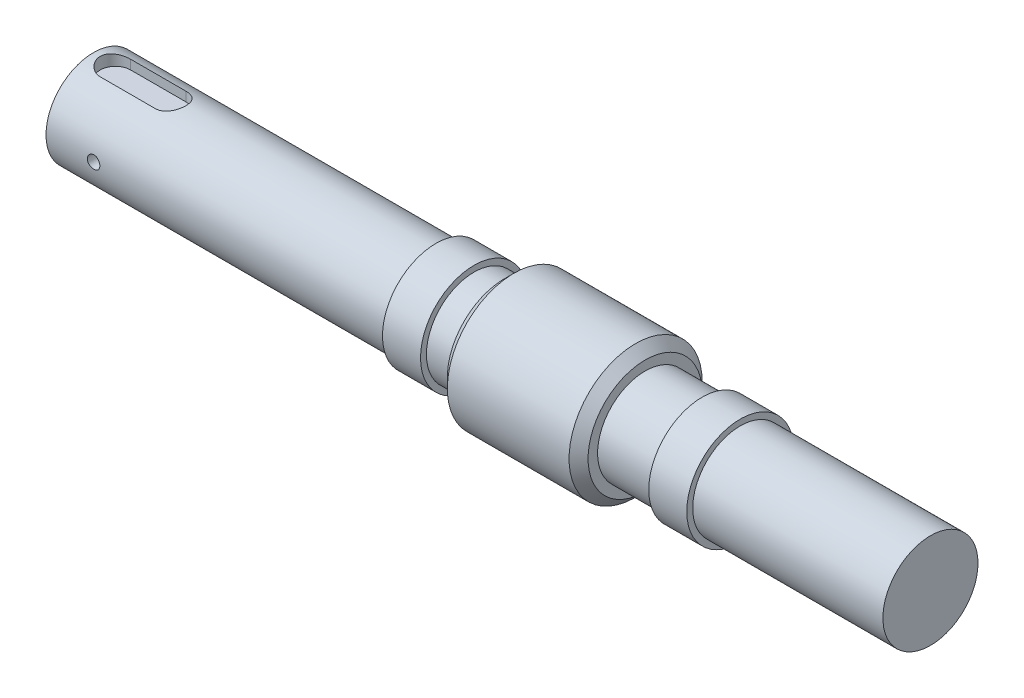
from build123d import *

# Parameters (mm, degrees)
CROQUIS1_R                                 = 35
SALIENTE_EXTRUIR1_DEPTH                    = 37
CHAFL_N1_SIZE                              = 5
CROQUIS2_R                                 = 25
SALIENTE_EXTRUIR2_DEPTH                    = 16
CROQUIS3_R                                 = 28.1
SALIENTE_EXTRUIR3_DEPTH                    = 120
SALIENTE_EXTRUIR4_START                    = 30
CROQUIS4_R                                 = 25
SALIENTE_EXTRUIR4_DEPTH                    = 30
SALIENTE_EXTRUIR5_START                    = 120
CROQUIS5_R                                 = 28.1
SALIENTE_EXTRUIR5_DEPTH                    = 120
CORTAR_EXTRUIR1_START                      = -100
CROQUIS6_R                                 = 28.1
CROQUIS6_R_2                               = 25
CORTAR_EXTRUIR1_DEPTH                      = 100
CROQUIS8_R                                 = 28.1
CROQUIS8_R_2                               = 25
CORTAR_EXTRUIR2_DEPTH                      = 100
CROQUIS9_R                                 = 25
SALIENTE_EXTRUIR6_DEPTH                    = 80
CORTAR_EXTRUIR3_START                      = 18.8
CORTAR_EXTRUIR3_DEPTH                      = 6.2
TALADRO_DE_MARGEN_PARA_M61_D               = 6.6
TALADRO_DE_MARGEN_PARA_M61_DEPTH           = 17
TALADRO_DE_MARGEN_PARA_M61_TIP             = 1.982840043
TALADRO_DE_MARGEN_PARA_M61_ON_FACE_2_D     = 6.6
TALADRO_DE_MARGEN_PARA_M61_ON_FACE_2_DEPTH = 17
TALADRO_DE_MARGEN_PARA_M61_ON_FACE_2_TIP   = 1.982840043
TALADRO_ROSCADO_M61_D                      = 5
TALADRO_ROSCADO_M61_DEPTH                  = 11.497848452
TALADRO_ROSCADO_M61_TIP                    = 1.502151548


with BuildPart() as part:
    # Croquis1 → Saliente-Extruir1 (new, symmetric)
    with BuildSketch(Plane(origin=(0, 0, 0), x_dir=(0, 0, -1), z_dir=(1, 0, 0))):
        Circle(CROQUIS1_R)
    extrude(amount=SALIENTE_EXTRUIR1_DEPTH, both=True)

    # Chaflán1
    chafl_n1_edges = [part.edges().sort_by_distance(p)[0] for p in [
        (37, 0, 35),
        (-37, 0, 35),
    ]]
    chamfer(chafl_n1_edges, length=CHAFL_N1_SIZE)

    # Croquis2 → Saliente-Extruir2 (add)
    with BuildSketch(Plane.ZY.offset(37)):
        Circle(CROQUIS2_R)
    extrude(amount=SALIENTE_EXTRUIR2_DEPTH)

    # Croquis3 → Saliente-Extruir3 (add)
    with BuildSketch(Plane.ZY.offset(53)):
        Circle(CROQUIS3_R)
    extrude(amount=SALIENTE_EXTRUIR3_DEPTH)

    # Croquis4 → Saliente-Extruir4 (add)
    with BuildSketch(Plane(origin=(37, 0, 0), x_dir=(0, 0, -1), z_dir=(1, 0, 0)).offset(SALIENTE_EXTRUIR4_START)):
        Circle(CROQUIS4_R)
    extrude(amount=-SALIENTE_EXTRUIR4_DEPTH)

    # Croquis5 → Saliente-Extruir5 (add)
    with BuildSketch(Plane(origin=(67, 0, 0), x_dir=(0, 0, -1), z_dir=(1, 0, 0)).offset(SALIENTE_EXTRUIR5_START)):
        Circle(CROQUIS5_R)
    extrude(amount=-SALIENTE_EXTRUIR5_DEPTH)

    # Croquis6 → Cortar-Extruir1 (cut)
    with BuildSketch(Plane.ZY.offset(173).offset(CORTAR_EXTRUIR1_START)):
        Circle(CROQUIS6_R)
        Circle(CROQUIS6_R_2, mode=Mode.SUBTRACT)
    extrude(amount=CORTAR_EXTRUIR1_DEPTH, mode=Mode.SUBTRACT)

    # Croquis8 → Cortar-Extruir2 (cut)
    with BuildSketch(Plane(origin=(187, 0, 0), x_dir=(0, 0, -1), z_dir=(1, 0, 0))):
        Circle(CROQUIS8_R)
        Circle(CROQUIS8_R_2, mode=Mode.SUBTRACT)
    extrude(amount=-CORTAR_EXTRUIR2_DEPTH, mode=Mode.SUBTRACT)

    # Croquis9 → Saliente-Extruir6 (add)
    with BuildSketch(Plane.ZY.offset(173)):
        Circle(CROQUIS9_R)
    extrude(amount=SALIENTE_EXTRUIR6_DEPTH)

    # Croquis10 → Cortar-Extruir3 (cut)
    with BuildSketch(Plane(origin=(0, 0, 0), x_dir=(1, 0, 0), z_dir=(0, 1, 0)).offset(CORTAR_EXTRUIR3_START)):
        with BuildLine():
            Line((-241.5, 8), (-212.5, 8))
            ThreePointArc((-212.5, 8), (-204.5, 0), (-212.5, -8))
            Line((-212.5, -8), (-241.5, -8))
            ThreePointArc((-241.5, -8), (-249.5, 0), (-241.5, 8))
        make_face()
    extrude(amount=CORTAR_EXTRUIR3_DEPTH, mode=Mode.SUBTRACT)

    # Taladro de margen para M61
    with Locations(Plane(origin=(-228, -25, 0), x_dir=(0, 0, -1), z_dir=(0, -1, 0))):
        with Locations((0, 0)):
            Hole(TALADRO_DE_MARGEN_PARA_M61_D / 2, depth=TALADRO_DE_MARGEN_PARA_M61_DEPTH)
            with Locations((0, 0, -(TALADRO_DE_MARGEN_PARA_M61_DEPTH + TALADRO_DE_MARGEN_PARA_M61_TIP / 2))):  # 118° drill point
                Cone(0, TALADRO_DE_MARGEN_PARA_M61_D / 2, TALADRO_DE_MARGEN_PARA_M61_TIP, mode=Mode.SUBTRACT)

    # Taladro de margen para M61 on face 2
    with Locations(Plane(origin=(-228, 0, 25), x_dir=(1, 0, 0), z_dir=(0, 0, 1))):
        with Locations((0, 0)):
            Hole(TALADRO_DE_MARGEN_PARA_M61_ON_FACE_2_D / 2, depth=TALADRO_DE_MARGEN_PARA_M61_ON_FACE_2_DEPTH)
            with Locations((0, 0, -(TALADRO_DE_MARGEN_PARA_M61_ON_FACE_2_DEPTH + TALADRO_DE_MARGEN_PARA_M61_ON_FACE_2_TIP / 2))):  # 118° drill point
                Cone(0, TALADRO_DE_MARGEN_PARA_M61_ON_FACE_2_D / 2, TALADRO_DE_MARGEN_PARA_M61_ON_FACE_2_TIP, mode=Mode.SUBTRACT)

    # Taladro roscado M61
    with Locations(Plane(origin=(-253, -17.5, 0), x_dir=(0, 0, -1), z_dir=(-1, 0, 0))):
        with Locations((0, 0)):
            Hole(TALADRO_ROSCADO_M61_D / 2, depth=TALADRO_ROSCADO_M61_DEPTH)
            with Locations((0, 0, -(TALADRO_ROSCADO_M61_DEPTH + TALADRO_ROSCADO_M61_TIP / 2))):  # 118° drill point
                Cone(0, TALADRO_ROSCADO_M61_D / 2, TALADRO_ROSCADO_M61_TIP, mode=Mode.SUBTRACT)


solid = part.part
